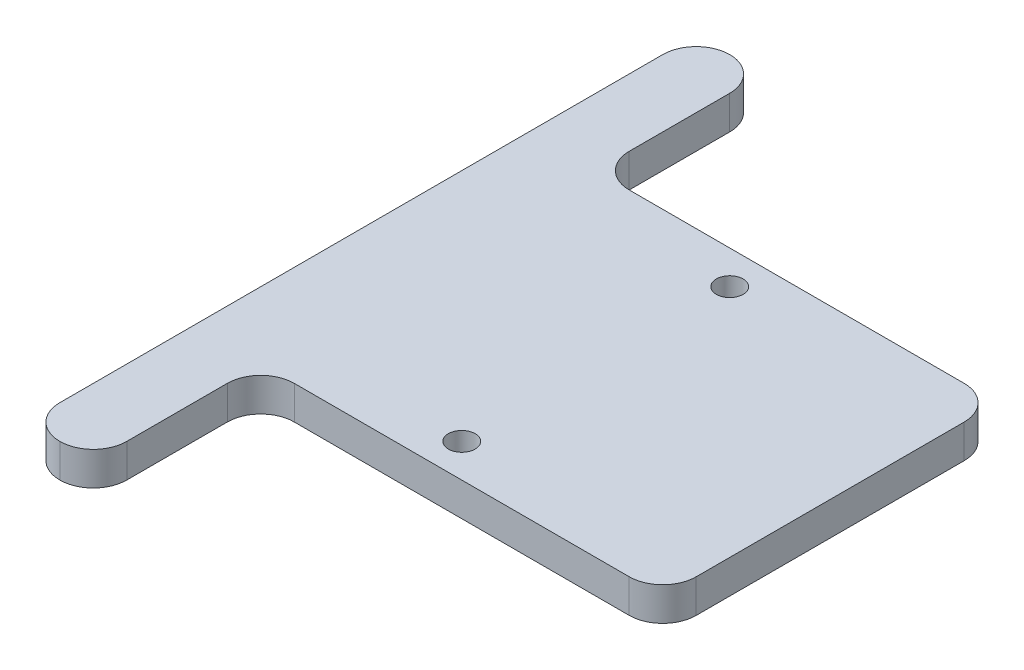
from build123d import *

# Parameters (mm, degrees)
SKETCH_2_R      = 2
EXTRUDE_1_DEPTH = 5
FILLET_1_R      = 5


with BuildPart() as part:
    # 스케치2 → 보스-돌출1 (new body)
    with BuildSketch(Plane(origin=(0, 0, 0), x_dir=(1, 0, 0), z_dir=(0, 1, 0))):
        Polygon((-60, -25), (-60, -50), (-70, -50), (-70, 50), (-60, 50), (-60, 25), (0, 25), (0, -25), align=None)
        with Locations(Location((-35, 20, 0), (0, 0, 270))):
            Circle(SKETCH_2_R, mode=Mode.SUBTRACT)
        with Locations(Location((-35, -20, 0), (0, 0, 90))):
            Circle(SKETCH_2_R, mode=Mode.SUBTRACT)
    extrude(amount=EXTRUDE_1_DEPTH)

    # 필렛1
    fillet_1_edges = [part.edges().sort_by_distance(p)[0] for p in [
        (-60, 2.5, -25),
        (0, 2.5, -25),
        (0, 2.5, 25),
        (-60, 2.5, 25),
        (-60, 2.5, 50),
        (-70, 2.5, 50),
        (-60, 2.5, -50),
        (-70, 2.5, -50),
    ]]
    fillet(fillet_1_edges, radius=FILLET_1_R - 0.0001)  # a hair under: the kernel refuses the full size


solid = part.part
